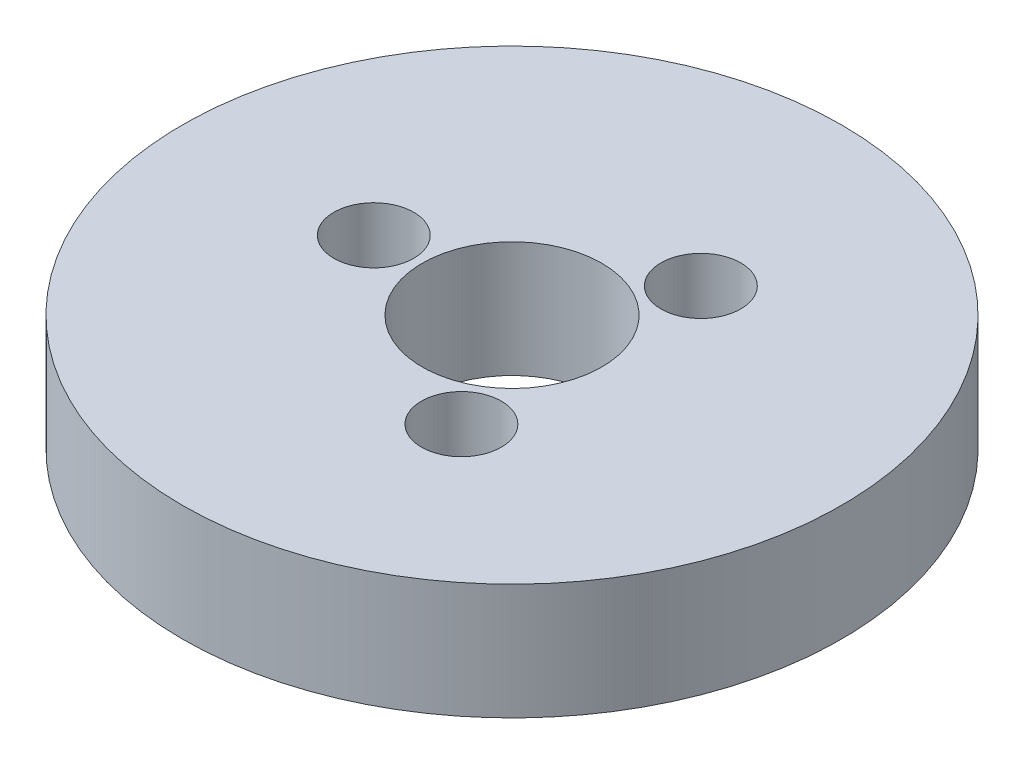
from build123d import *

# Parameters (mm, degrees)
SKETCH1_R           = 82.5
BOSS_EXTRUDE1_DEPTH = 29
SKETCH2_R           = 22.5
CUT_EXTRUDE1_DEPTH  = 121.222710001
SKETCH3_R           = 10
CUT_EXTRUDE2_DEPTH  = 19.897631285
CIRPATTERN1_COUNT   = 3


with BuildPart() as part:
    # Sketch1 → Boss-Extrude1 (new body)
    with BuildSketch(Plane(origin=(0, 0, 0), x_dir=(1, 0, 0), z_dir=(0, 1, 0))):
        Circle(SKETCH1_R)
    extrude(amount=BOSS_EXTRUDE1_DEPTH)

    # Sketch2 → Cut-Extrude1 (cut, through all)
    with BuildSketch(Plane(origin=(0, 0, 0), x_dir=(1, 0, 0), z_dir=(0, 1, 0))):
        Circle(SKETCH2_R)
    extrude(amount=CUT_EXTRUDE1_DEPTH, mode=Mode.SUBTRACT)

    # Sketch3 → Cut-Extrude2 (cut)
    with BuildSketch(Plane(origin=(0, 29, 0), x_dir=(1, 0, 0), z_dir=(0, 1, 0))):
        with Locations((-34.605029939, 0)):
            Circle(SKETCH3_R)
    cut_extrude2 = extrude(amount=-CUT_EXTRUDE2_DEPTH, mode=Mode.SUBTRACT)

    # CirPattern1: Cut-Extrude2 ×3 about axis
    cirpattern1_axis = Axis((0, 0, 0), (0, 1, 0))
    for i in range(1, CIRPATTERN1_COUNT):
        add(cut_extrude2.rotate(cirpattern1_axis, i * 360 / CIRPATTERN1_COUNT), mode=Mode.SUBTRACT)


solid = part.part
